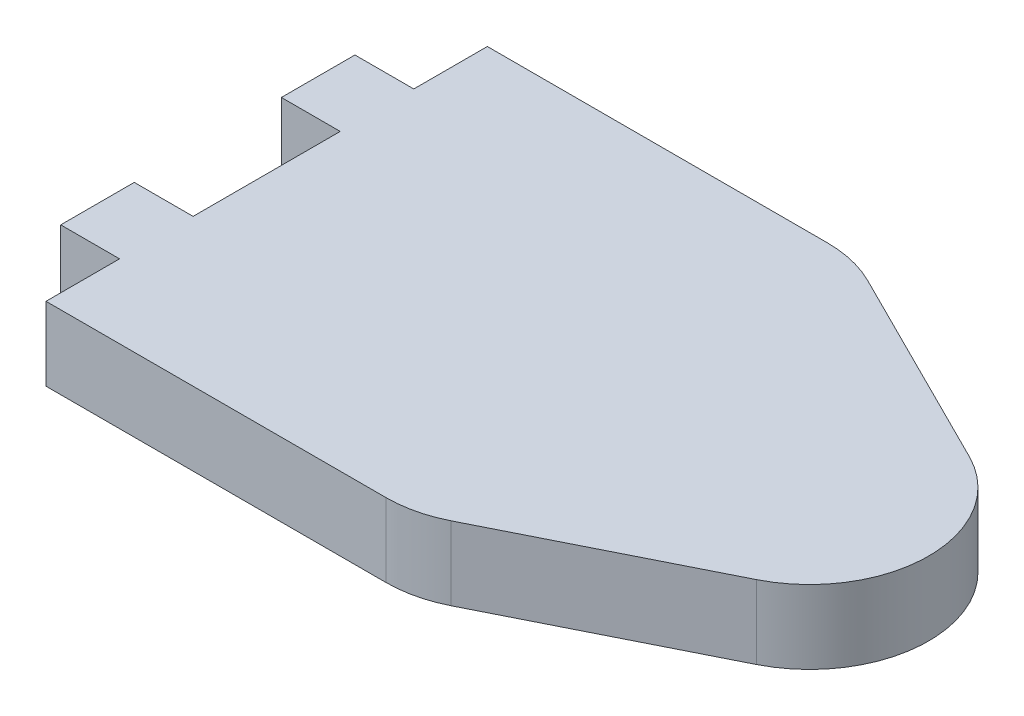
from build123d import *

# Parameters (mm, degrees)
BOSS_EXTRUDE2_DEPTH = 10
CUT_EXTRUDE2_DEPTH  = 10
FILLET3_R           = 16


with BuildPart() as part:
    # Sketch1 → Boss-Extrude2 (new body)
    with BuildSketch(Plane(origin=(0, 0, 0), x_dir=(1, 0, 0), z_dir=(0, 1, 0))):
        Polygon((0, 0), (0, 10), (-8, 10), (-8, 20), (0, 20), (0, 40), (-8, 40), (-8, 50), (0, 50), (0, 60), (50, 60), (90, 40), (90, 20), (50, 0), align=None)
    extrude(amount=BOSS_EXTRUDE2_DEPTH)

    # Sketch5 → Cut-Extrude2 (cut)
    with BuildSketch(Plane(origin=(0, 10, 0), x_dir=(1, 0, 0), z_dir=(0, 1, 0))):
        with BuildLine():
            Line((90, 20), (90, 30))
            ThreePointArc((90, 30), (87.583479317, 21.493491916), (81.05572809, 15.527864045))
            Line((81.05572809, 15.527864045), (90, 20))
        make_face()
        with BuildLine():
            Line((90, 40), (81.05572809, 44.472135955))
            ThreePointArc((81.05572809, 44.472135955), (87.583479317, 38.506508084), (90, 30))
            Line((90, 30), (90, 40))
        make_face()
    extrude(amount=-CUT_EXTRUDE2_DEPTH, mode=Mode.SUBTRACT)

    # Fillet3
    fillet3_edges = [part.edges().sort_by_distance(p)[0] for p in [
        (50, 5, -60),
        (50, 5, 0),
    ]]
    fillet(fillet3_edges, radius=FILLET3_R)


solid = part.part
